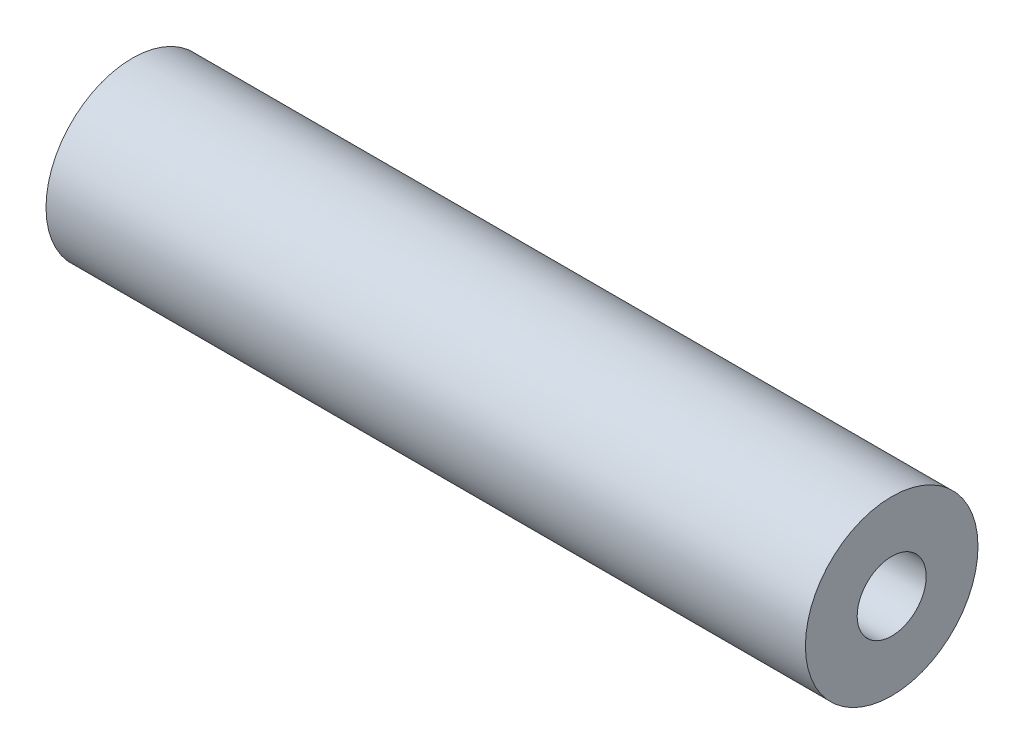
from build123d import *

# Parameters (mm, degrees)
SKETCH1_W = 110
SKETCH1_H = 7.5


with BuildPart() as part:
    # Sketch1 → Revolve1 (revolve)
    with BuildSketch(Plane.XY):
        with Locations((75, 8.75)):
            Rectangle(SKETCH1_W, SKETCH1_H)
    revolve(axis=Axis((0, 0, 0), (1, 0, 0)))


solid = part.part
